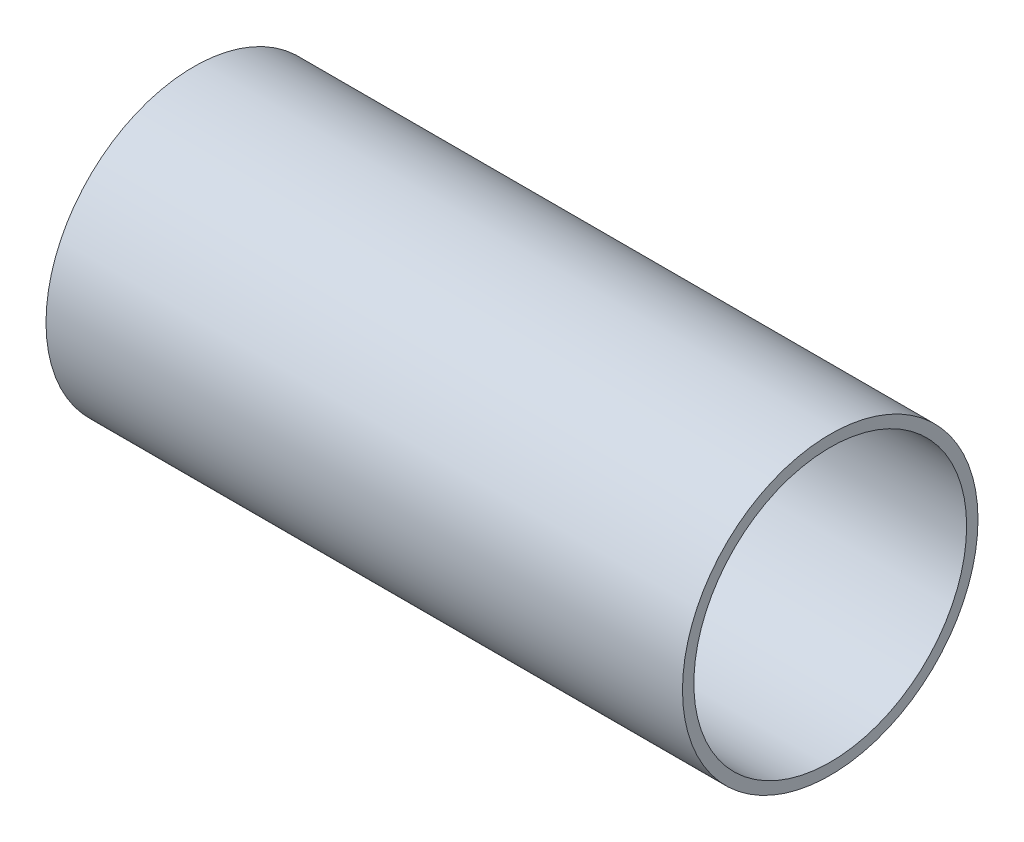
from build123d import *

# Parameters (mm, degrees)
SKETCH1_R           = 41.275
SKETCH1_R_2         = 38.1
BOSS_EXTRUDE1_DEPTH = 177.8


with BuildPart() as part:
    # Sketch1 → Boss-Extrude1 (new body)
    with BuildSketch(Plane(origin=(0, 0, 0), x_dir=(0, 0, -1), z_dir=(1, 0, 0))):
        Circle(SKETCH1_R)
        Circle(SKETCH1_R_2, mode=Mode.SUBTRACT)
    extrude(amount=BOSS_EXTRUDE1_DEPTH)


solid = part.part
